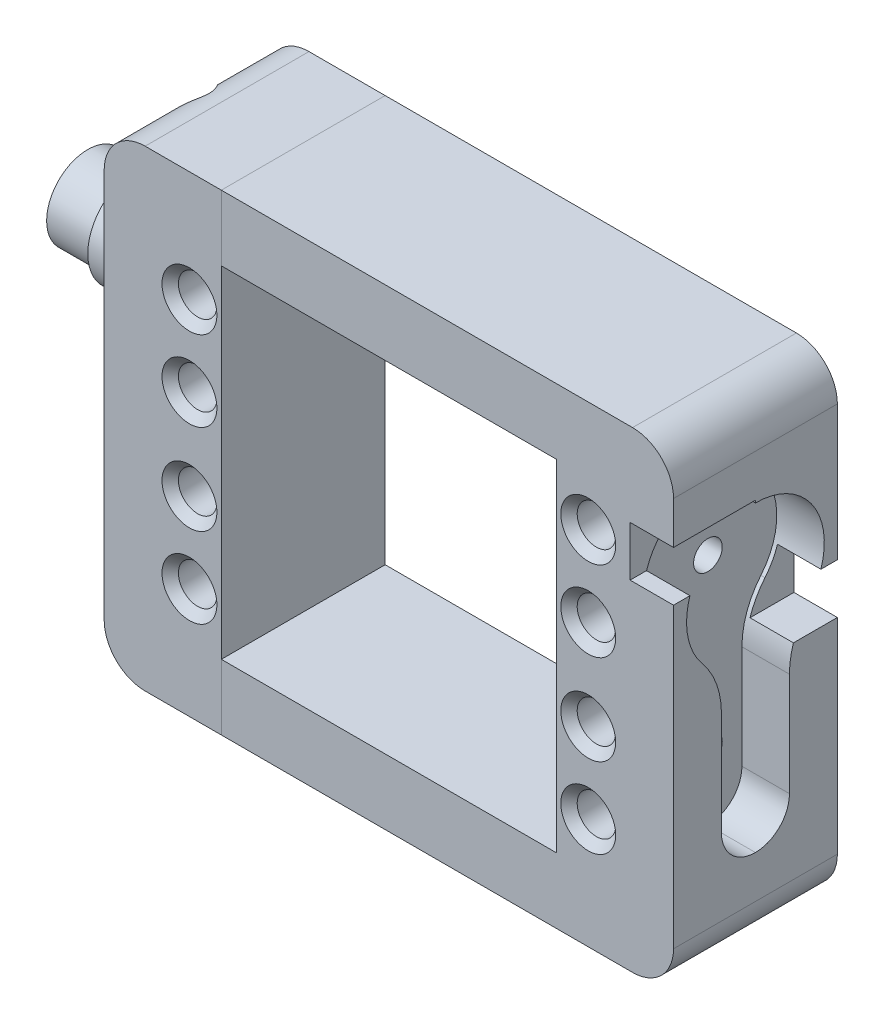
from build123d import *

# Parameters (mm, degrees)
SKETCH1_W              = 20
SKETCH1_H              = 20
BOSS_EXTRUDE1_DEPTH    = 20
SKETCH2_W              = 20
SKETCH2_H              = 70
BOSS_EXTRUDE2_DEPTH    = 10.3
CUT_EXTRUDE1_DEPTH     = 5.8
FILLET1_R              = 4.15
FILLET2_R              = 10
SKETCH5_R              = 1.75
CUT_EXTRUDE2_DEPTH     = 48.361271098
CUT_EXTRUDE3_REACH     = 45.878
SKETCH6_R              = 1.75
SKETCH13_W             = 20
SKETCH13_H             = 20
CUT_EXTRUDE9_DEPTH     = 20
CUT_EXTRUDE18_DEPTH    = 5.3
SKETCH32_W             = 20
SKETCH32_H             = 3.725
BOSS_EXTRUDE3_DEPTH    = 10.3
SKETCH31_W             = 20
SKETCH31_H             = 16.125
CUT_EXTRUDE19_DEPTH    = 42.300310229
SKETCH34_W             = 20
SKETCH34_H             = 57.6
SKETCH34_R             = 1.75
BOSS_EXTRUDE5_DEPTH    = 4
SKETCH35_W             = 20
SKETCH35_H             = 8
BOSS_EXTRUDE6_DEPTH    = 40.9
SKETCH37_W             = 20
SKETCH37_H             = 57.6
BOSS_EXTRUDE7_DEPTH    = 14.3
SKETCH38_R             = 2.35
CUT_EXTRUDE20_DEPTH    = 8
CHAMFER1_SIZE          = 1
SKETCH41_R             = 3.5
CUT_EXTRUDE23_DEPTH    = 4
SKETCH42_R             = 1.75
CUT_EXTRUDE24_DEPTH    = 22.3
SKETCH43_R             = 3.5
CUT_EXTRUDE25_DEPTH    = 11
FILLET3_R              = 5
SPLIT1_SURFACE_1_BACK  = 93.455
SPLIT1_SURFACE_1_DEPTH = 186.91
SPLIT1_SURFACE_2_BACK  = 93.455
SPLIT1_SURFACE_2_DEPTH = 186.91
SKETCH45_R             = 2.35
CUT_EXTRUDE26_DEPTH    = 8
CHAMFER2_SIZE          = 1
SKETCH46_R             = 5.025
BOSS_EXTRUDE8_DEPTH    = 12
SKETCH50_R             = 6
BOSS_EXTRUDE9_DEPTH    = 6
FILLET6_R              = 3


# Some blends are built 0.0001 mm under size
with BuildPart() as part:
    # Sketch1 → Boss-Extrude1 (new body)
    with BuildSketch(Plane(origin=(0, 0, 0), x_dir=(0, 0, -1), z_dir=(1, 0, 0))):
        Rectangle(SKETCH1_W, SKETCH1_H)
    extrude(amount=BOSS_EXTRUDE1_DEPTH)

    # Sketch2 → Boss-Extrude2 (add)
    with BuildSketch(Plane(origin=(20, 0, 0), x_dir=(0, 0, -1), z_dir=(1, 0, 0))):
        Rectangle(SKETCH2_W, SKETCH2_H)
    extrude(amount=BOSS_EXTRUDE2_DEPTH)

    # Sketch4 → Cut-Extrude1 (cut)
    with BuildSketch(Plane(origin=(30.3, 0, 0), x_dir=(0, 0, -1), z_dir=(1, 0, 0))):
        with BuildLine():
            Line((4.15, -28.55), (-4.15, -28.55))
            Line((-4.15, -28.55), (-4.15, -7.311805523))
            ThreePointArc((-4.15, -7.311805523), (0, 8.407437184), (4.15, -7.311805523))
            Line((4.15, -7.311805523), (4.15, -28.55))
        make_face()
    extrude(amount=-CUT_EXTRUDE1_DEPTH, mode=Mode.SUBTRACT)

    # Fillet1
    fillet1_edges = [part.edges().sort_by_distance(p)[0] for p in [
        (27.4, -28.55, 4.15),
        (27.4, -28.55, -4.15),
    ]]
    fillet(fillet1_edges, radius=FILLET1_R - 0.0001)  # a hair under: the kernel refuses the full size

    # Fillet2
    fillet2_edges = [part.edges().sort_by_distance(p)[0] for p in [
        (27.4, -7.311805523, 4.15),
        (27.4, -7.311805523, -4.15),
    ]]
    fillet(fillet2_edges, radius=FILLET2_R)

    # Sketch5 → Cut-Extrude2 (cut, through all)
    with BuildSketch(Plane.ZY):
        Circle(SKETCH5_R)
    extrude(amount=-CUT_EXTRUDE2_DEPTH, mode=Mode.SUBTRACT)

    # Sketch6 → Cut-Extrude3 (cut, up to next)
    with BuildSketch(Plane(origin=(24.5, 0, 0), x_dir=(0, 0, -1), z_dir=(1, 0, 0)), mode=Mode.PRIVATE) as cut_extrude3_sk1:
        with Locations((0, -20.6)):
            Circle(SKETCH6_R)
    cut_extrude3_tool1 = extrude(cut_extrude3_sk1.sketch, amount=-CUT_EXTRUDE3_REACH, mode=Mode.PRIVATE) & part.part
    add(cut_extrude3_tool1.solids().sort_by_distance((24.5, -20.6, 0))[0], mode=Mode.SUBTRACT)

    # Sketch13 → Cut-Extrude9 (cut)
    with BuildSketch(Plane.ZY):
        Rectangle(SKETCH13_W, SKETCH13_H)
    extrude(amount=-CUT_EXTRUDE9_DEPTH, mode=Mode.SUBTRACT)

    # Sketch29 → Cut-Extrude18 (cut)
    with BuildSketch(Plane(origin=(30.3, 0, 0), x_dir=(0, 0, -1), z_dir=(1, 0, 0))):
        Polygon((15.109449768, -8.7), (15.109449768, -2.6), (0, -2.6), (0, -3.8), (0, -7.5), (0, -8.7), align=None)
        Polygon((0, 2.6), (-15.109449768, 2.6), (-15.109449768, 8.7), (0, 8.7), (0, 7.5), (0, 3.8), align=None)
    extrude(amount=-CUT_EXTRUDE18_DEPTH, mode=Mode.SUBTRACT)

    # Sketch32 → Boss-Extrude3 (add)
    with BuildSketch(Plane(origin=(30.3, 0, 0), x_dir=(0, 0, -1), z_dir=(1, 0, 0))):
        with Locations((0, -36.8625)):
            Rectangle(SKETCH32_W, SKETCH32_H)
    extrude(amount=-BOSS_EXTRUDE3_DEPTH)

    # Sketch31 → Cut-Extrude19 (cut, through all)
    with BuildSketch(Plane(origin=(30.3, 0, 0), x_dir=(0, 0, -1), z_dir=(1, 0, 0))):
        with Locations((0, 26.9375)):
            Rectangle(SKETCH31_W, SKETCH31_H)
    extrude(amount=-CUT_EXTRUDE19_DEPTH, mode=Mode.SUBTRACT)

    # Sketch34 → Boss-Extrude5 (add)
    with BuildSketch(Plane.ZY.offset(-20)):
        with Locations((0, -9.925)):
            Rectangle(SKETCH34_W, SKETCH34_H)
        with Locations(Location((0, -20.6, 0), (0, 0, 180))):
            Circle(SKETCH34_R, mode=Mode.SUBTRACT)
        Circle(SKETCH34_R, mode=Mode.SUBTRACT)
    extrude(amount=BOSS_EXTRUDE5_DEPTH)

    # Sketch35 → Boss-Extrude6 (add)
    with BuildSketch(Plane.ZY.offset(-16)):
        with Locations((0, 14.875)):
            Rectangle(SKETCH35_W, SKETCH35_H)
        with Locations((0, -34.725)):
            Rectangle(SKETCH35_W, SKETCH35_H)
    extrude(amount=BOSS_EXTRUDE6_DEPTH)

    # Sketch37 → Boss-Extrude7 (add)
    with BuildSketch(Plane.ZY.offset(24.9)):
        with Locations((0, -9.925)):
            Rectangle(SKETCH37_W, SKETCH37_H)
    extrude(amount=BOSS_EXTRUDE7_DEPTH)

    # Sketch38 → Cut-Extrude20 (cut)
    with BuildSketch(Plane.XY.offset(10)):
        with Locations((-28.79, 5.375)):
            Circle(SKETCH38_R)
        with Locations(Location((-28.79, -4.425, 0), (0, 0, 180))):
            Circle(SKETCH38_R)
        with Locations(Location((-28.79, -25.225, 0), (0, 0, 180))):
            Circle(SKETCH38_R)
        with Locations((-28.79, -15.425)):
            Circle(SKETCH38_R)
        with Locations(Location((19.89, 5.375, 0), (0, 0, 180))):
            Circle(SKETCH38_R)
        with Locations((19.89, -4.425)):
            Circle(SKETCH38_R)
        with Locations(Location((19.89, -15.425, 0), (0, 0, 180))):
            Circle(SKETCH38_R)
        with Locations((19.89, -25.225)):
            Circle(SKETCH38_R)
    extrude(amount=-CUT_EXTRUDE20_DEPTH, mode=Mode.SUBTRACT)

    # Chamfer1
    chamfer1_edges = [part.edges().sort_by_distance(p)[0] for p in [
        (22.24, 5.375, 10),
        (-31.14, -15.425, 10),
        (-26.44, -25.225, 10),
        (-26.44, -4.425, 10),
        (17.54, -4.425, 10),
        (22.24, -15.425, 10),
        (17.54, -25.225, 10),
        (-31.14, 5.375, 10),
    ]]
    chamfer(chamfer1_edges, length=CHAMFER1_SIZE)

    # Sketch41 → Cut-Extrude23 (cut)
    with BuildSketch(Plane.ZY.offset(-16)):
        Circle(SKETCH41_R)
        with Locations((0, -20.6)):
            Circle(SKETCH41_R)
    extrude(amount=-CUT_EXTRUDE23_DEPTH, mode=Mode.SUBTRACT)

    # Sketch42 → Cut-Extrude24 (cut)
    with BuildSketch(Plane.ZY.offset(39.2)):
        with Locations((0, -34.725)):
            Circle(SKETCH42_R)
        with Locations(Location((0, 14.875, 0), (0, 0, 180))):
            Circle(SKETCH42_R)
    extrude(amount=-CUT_EXTRUDE24_DEPTH, mode=Mode.SUBTRACT)

    # Sketch43 → Cut-Extrude25 (cut)
    with BuildSketch(Plane.ZY.offset(39.2)):
        with Locations((0, 14.875)):
            Circle(SKETCH43_R)
        with Locations((0, -34.725)):
            Circle(SKETCH43_R)
    extrude(amount=-CUT_EXTRUDE25_DEPTH, mode=Mode.SUBTRACT)

    # Fillet3
    # the kernel refuses this fillet: 5 mm, written as the material it takes off along each edge
    with BuildSketch(Plane(origin=(30.3, -38.725, -22.5), x_dir=(-1, 0, 0), z_dir=(0, 0, 1)), Plane(origin=(-39.2, 18.875, -22.5), x_dir=(1, 0, 0), z_dir=(0, 0, 1))) as fillet3_piece_1:
        with BuildLine():
            CenterArc((FILLET3_R, -FILLET3_R), FILLET3_R, 90, 90)
            Line((0, -FILLET3_R), (0, 0))
            Line((0, 0), (FILLET3_R, 0))
        make_face()
    extrude(amount=45, mode=Mode.SUBTRACT)
    with BuildSketch(Plane(origin=(30.3, 18.875, -22.5), x_dir=(-1, 0, 0), z_dir=(0, 0, 1)), Plane(origin=(-39.2, -38.725, 22.5), x_dir=(0, 1, 0), z_dir=(0, 0, -1))) as fillet3_piece_2:
        with BuildLine():
            CenterArc((FILLET3_R, FILLET3_R), FILLET3_R, 180, 90)
            Line((0, FILLET3_R), (0, 0))
            Line((0, 0), (FILLET3_R, 0))
        make_face()
    extrude(amount=45, mode=Mode.SUBTRACT)


with BuildPart() as body_2:
    # Split1: the piece behind the surface
    add(part.part)
    # Split1 surface: a surface, the sketch's curves swept straight by 186.91 mm
    with BuildLine(Plane.XY.offset(10).offset(-SPLIT1_SURFACE_1_BACK), mode=Mode.PRIVATE) as split1_surface_1_path:
        Line((-24.9, 18.875), (-24.9, -38.725))
    split1_surface_1 = Shell.extrude(split1_surface_1_path.wire(), (0 * SPLIT1_SURFACE_1_DEPTH, 0 * SPLIT1_SURFACE_1_DEPTH, 1 * SPLIT1_SURFACE_1_DEPTH))
    split(bisect_by=split1_surface_1, keep=Keep.BOTTOM)

    # Sketch46 → Boss-Extrude8 (add)
    with BuildSketch(Plane.ZY.offset(39.2)):
        Circle(SKETCH46_R)
    extrude(amount=BOSS_EXTRUDE8_DEPTH)

    # Sketch50 → Boss-Extrude9 (add)
    with BuildSketch(Plane.ZY.offset(39.2)):
        Circle(SKETCH50_R)
    extrude(amount=BOSS_EXTRUDE9_DEPTH)

    # Fillet6
    fillet6_edges = [body_2.edges().sort_by_distance(p)[0] for p in [
        (-39.2, 0, -6),
    ]]
    fillet(fillet6_edges, radius=FILLET6_R)


with BuildPart() as part_1:
    add(part.part)

    # Split1: split by a surface, the side it looks to stays
    # Split1 surface: a surface, the sketch's curves swept straight by 186.91 mm
    with BuildLine(Plane.XY.offset(10).offset(-SPLIT1_SURFACE_2_BACK), mode=Mode.PRIVATE) as split1_surface_2_path:
        Line((-24.9, 18.875), (-24.9, -38.725))
    split1_surface_2 = Shell.extrude(split1_surface_2_path.wire(), (0 * SPLIT1_SURFACE_2_DEPTH, 0 * SPLIT1_SURFACE_2_DEPTH, 1 * SPLIT1_SURFACE_2_DEPTH))
    split(bisect_by=split1_surface_2, keep=Keep.TOP)

    # Sketch45 → Cut-Extrude26 (cut)
    with BuildSketch(Plane.ZY.offset(24.9)):
        with Locations((0, 14.875)):
            Circle(SKETCH45_R)
        with Locations((0, -34.725)):
            Circle(SKETCH45_R)
    extrude(amount=-CUT_EXTRUDE26_DEPTH, mode=Mode.SUBTRACT)

    # Chamfer2
    chamfer2_edges = [part_1.edges().sort_by_distance(p)[0] for p in [
        (-24.9, 14.875, -2.35),
        (-24.9, -34.725, -2.35),
    ]]
    chamfer(chamfer2_edges, length=CHAMFER2_SIZE)


solid = Compound([body_2.part, part_1.part])
